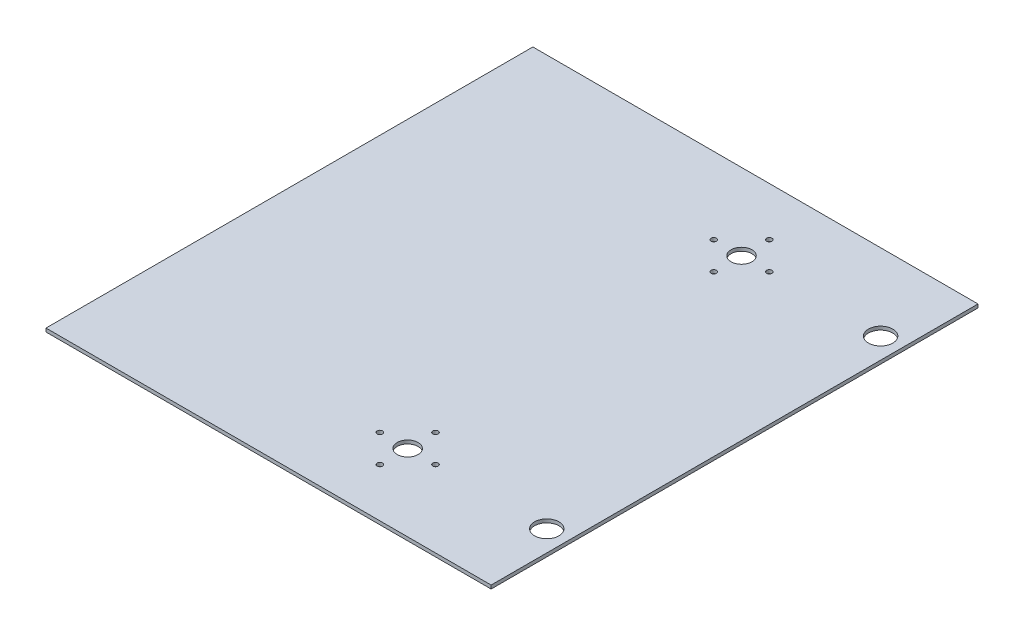
from build123d import *

# Parameters (mm, degrees)
SKETCH1_W                    = 406.4
SKETCH1_H                    = 444.5
BOSS_EXTRUDE1_DEPTH          = 3.175
CUT_EXTRUDE2_DEPTH           = 302.156741789
F_10_0_1935_DIAMETER_HOLE1_D = 4.9149
SKETCH7_R                    = 11.1125
CUT_EXTRUDE3_DEPTH           = 302.156741789


with BuildPart() as part:
    # Sketch1 → Boss-Extrude1 (new body)
    with BuildSketch(Plane(origin=(0, 0, 0), x_dir=(1, 0, 0), z_dir=(0, 1, 0))):
        Rectangle(SKETCH1_W, SKETCH1_H)
    extrude(amount=BOSS_EXTRUDE1_DEPTH)

    # Sketch3 → Cut-Extrude2 (cut, through all)
    with BuildSketch(Plane(origin=(0, 3.175, 0), x_dir=(1, 0, 0), z_dir=(0, 1, 0))):
        with BuildLine():
            ThreePointArc((66.675, -152.4), (57.15, -142.875), (47.625, -152.4))
            ThreePointArc((47.625, -152.4), (57.15, -161.925), (66.675, -152.4))
        make_face()
        with BuildLine():
            ThreePointArc((66.675, 152.4), (57.15, 161.925), (47.625, 152.4))
            ThreePointArc((47.625, 152.4), (57.15, 142.875), (66.675, 152.4))
        make_face()
    extrude(amount=-CUT_EXTRUDE2_DEPTH, mode=Mode.SUBTRACT)

    # #10 (0.1935) Diameter Hole1 (through all)
    with Locations(Plane(origin=(0, 3.175, 0), x_dir=(1, 0, 0), z_dir=(0, 1, 0))):
        with Locations((57.15, -177.8), (31.75, -152.4), (57.15, -127), (82.55, -152.4), (57.15, 177.8), (31.75, 152.4), (57.15, 127), (82.55, 152.4)):
            Hole(F_10_0_1935_DIAMETER_HOLE1_D / 2)

    # Sketch7 → Cut-Extrude3 (cut, through all)
    with BuildSketch(Plane(origin=(0, 3.175, 0), x_dir=(1, 0, 0), z_dir=(0, 1, 0))):
        with Locations((184.15, -152.4)):
            Circle(SKETCH7_R)
        with Locations((184.15, 152.4)):
            Circle(SKETCH7_R)
    extrude(amount=-CUT_EXTRUDE3_DEPTH, mode=Mode.SUBTRACT)


solid = part.part
